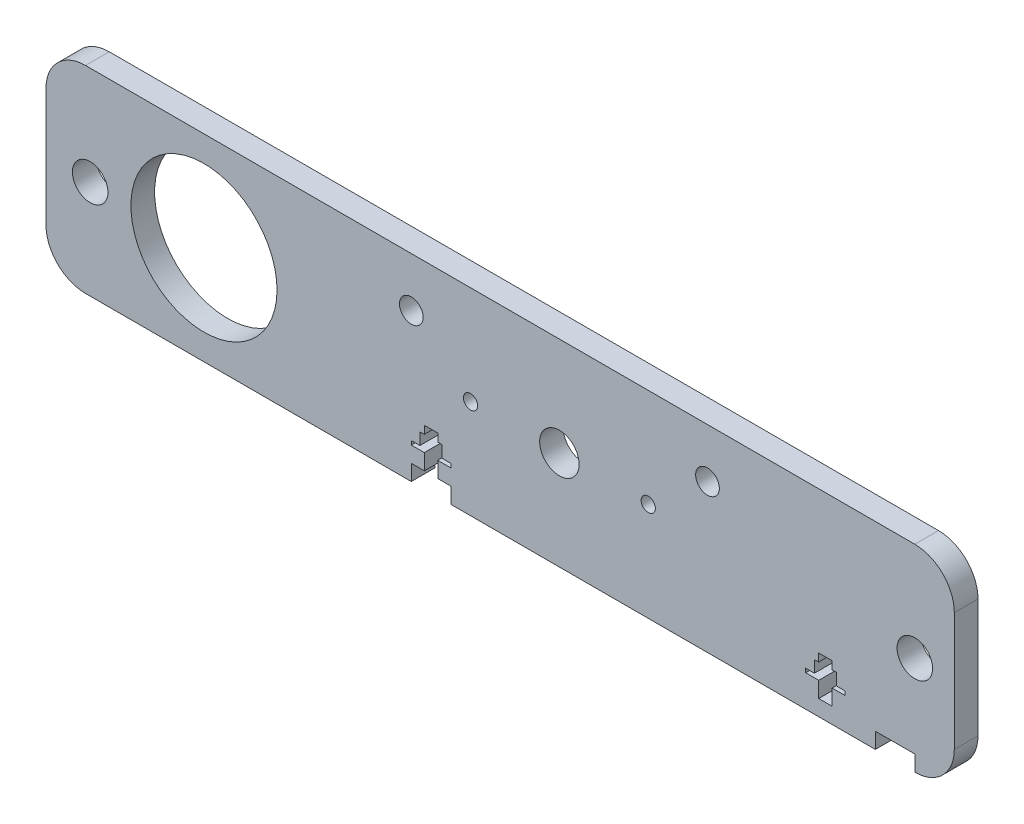
from build123d import *

# Parameters (mm, degrees)
ESBO_O1_R                = 4.5
ESBO_O1_R_2              = 18.5
ESBO_O1_R_3              = 1.8
ESBO_O1_R_4              = 3
ESBO_O1_R_5              = 5
RESSALTO_EXTRUS_O1_DEPTH = 6


with BuildPart() as part:
    # Esboço1 → Ressalto-extrusão1 (new body)
    with BuildSketch(Plane.XY):
        with BuildLine():
            Line((105, -21), (105, -25))
            ThreePointArc((105, -25), (112.071067812, -22.071067812), (115, -15))
            Line((115, -15), (115, 15))
            ThreePointArc((115, 15), (112.071067812, 22.071067812), (105, 25))
            Line((105, 25), (-105, 25))
            ThreePointArc((-105, 25), (-112.071067812, 22.071067812), (-115, 15))
            Line((-115, 15), (-115, -15))
            ThreePointArc((-115, -15), (-112.071067812, -22.071067812), (-105, -25))
            Line((-105, -25), (-22.5, -25))
            Line((-22.5, -25), (-22.5, -21))
            Line((-22.5, -21), (-19.2, -21))
            Line((-19.2, -21), (-19.2, -17))
            Line((-19.2, -17), (-22.5, -17))
            Line((-22.5, -17), (-22.5, -16))
            Line((-22.5, -16), (-20.3, -16))
            Line((-20.3, -16), (-20.3, -13))
            Line((-20.3, -13), (-19.2, -13))
            Line((-19.2, -13), (-19.2, -11))
            Line((-19.2, -11), (-15.8, -11))
            Line((-15.8, -11), (-15.8, -13))
            Line((-15.8, -13), (-14.7, -13))
            Line((-14.7, -13), (-14.7, -16))
            Line((-14.7, -16), (-12.5, -16))
            Line((-12.5, -16), (-12.5, -17))
            Line((-12.5, -17), (-15.8, -17))
            Line((-15.8, -17), (-15.8, -21))
            Line((-15.8, -21), (-12.5, -21))
            Line((-12.5, -21), (-12.5, -25))
            Line((-12.5, -25), (95, -25))
            Line((95, -25), (95, -21))
            Line((95, -21), (105, -21))
        make_face()
        Polygon((84.069964443, -17), (84.069964443, -21), (80.669964443, -21), (80.669964443, -17), (77.369964443, -17), (77.369964443, -16), (79.569964443, -16), (79.569964443, -13), (80.669964443, -13), (80.669964443, -11), (84.069964443, -11), (84.069964443, -13), (85.169964443, -13), (85.169964443, -16), (87.369964443, -16), (87.369964443, -17), align=None, mode=Mode.SUBTRACT)
        with Locations((-103.81, 0)):
            Circle(ESBO_O1_R, mode=Mode.SUBTRACT)
        with Locations((-75, 0)):
            Circle(ESBO_O1_R_2, mode=Mode.SUBTRACT)
        with Locations((-7.5, 0)):
            Circle(ESBO_O1_R_3, mode=Mode.SUBTRACT)
        with Locations((-22.5, 12.5)):
            Circle(ESBO_O1_R_4, mode=Mode.SUBTRACT)
        with Locations((15, 0)):
            Circle(ESBO_O1_R_5, mode=Mode.SUBTRACT)
        with Locations((37.5, 0)):
            Circle(ESBO_O1_R_3, mode=Mode.SUBTRACT)
        with Locations((105, 0)):
            Circle(ESBO_O1_R, mode=Mode.SUBTRACT)
        with Locations((52.5, 12.5)):
            Circle(ESBO_O1_R_4, mode=Mode.SUBTRACT)
    extrude(amount=RESSALTO_EXTRUS_O1_DEPTH)


solid = part.part
